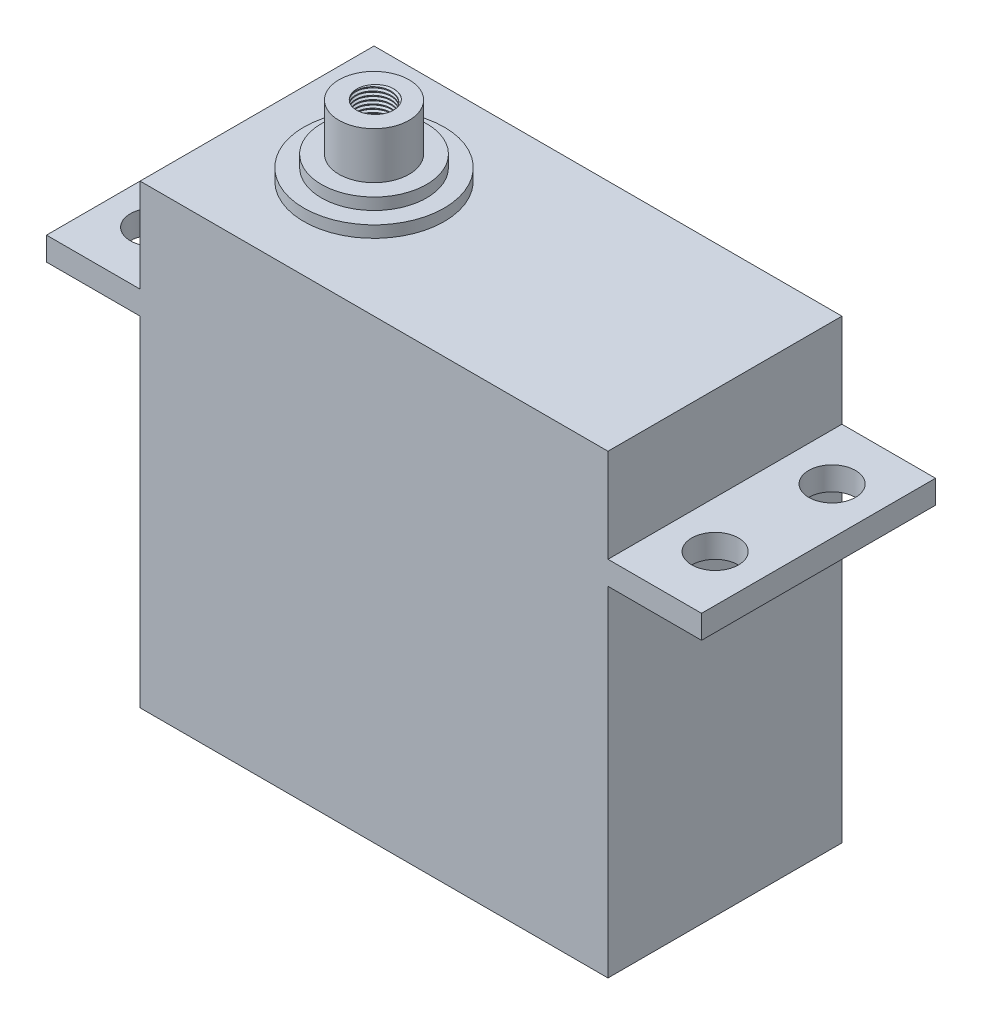
from build123d import *

# Parameters (mm, degrees)
EXTRUDE_2_DEPTH     = 20
SKETCH_5_R          = 3
EXTRUDE_4_DEPTH     = 14
SKETCH_5_4_R        = 6
EXTRUDE_5_DEPTH     = 9
SKETCH_5_5_R        = 4.5
EXTRUDE_6_DEPTH     = 10
SKETCH_5_6_R        = 2
CUT_EXTRUDE_1_DEPTH = 10
SKETCH_5_7_R        = 2
CUT_EXTRUDE_2_DEPTH = 10
SKETCH_5_8_R        = 2
CUT_EXTRUDE_3_DEPTH = 10
SKETCH_5_9_R        = 2
CUT_EXTRUDE_4_DEPTH = 10
SKETCH_6_R          = 1.5
CUT_EXTRUDE_5_DEPTH = 4
THREAD_1_PITCH      = 0.3175


with BuildPart() as part:
    # Sketch 1 → 凸台-拉伸2 (new body)
    with BuildSketch(Plane.XY):
        Polygon((-20, 12.315978), (-20, 4.315978), (-28, 4.315978), (-28, 2.315978), (-20, 2.315978), (-20, -26.684022), (20, -26.684022), (20, 2.315978), (28, 2.315978), (28, 4.315978), (20, 4.315978), (20, 12.315978), align=None)
    extrude(amount=EXTRUDE_2_DEPTH)

    # 草图5 → 凸台-拉伸4 (add)
    with BuildSketch(Plane(origin=(0, 4.315978, 0), x_dir=(1, 0, 0), z_dir=(0, 1, 0))):
        with Locations((-10, -10)):
            Circle(SKETCH_5_R)
    extrude(amount=EXTRUDE_4_DEPTH)

    # 草图5<4> → 凸台-拉伸5 (add)
    with BuildSketch(Plane(origin=(0, 4.315978, 0), x_dir=(1, 0, 0), z_dir=(0, 1, 0))):
        with Locations((-10, -10)):
            Circle(SKETCH_5_4_R)
    extrude(amount=EXTRUDE_5_DEPTH)

    # 草图5<5> → 凸台-拉伸6 (add)
    with BuildSketch(Plane(origin=(0, 4.315978, 0), x_dir=(1, 0, 0), z_dir=(0, 1, 0))):
        with Locations(Location((-10, -10, 0), (0, 0, 180))):
            Circle(SKETCH_5_5_R)
    extrude(amount=EXTRUDE_6_DEPTH)

    # 草图5<6> → 切除-拉伸1 (cut)
    with BuildSketch(Plane(origin=(0, 4.315978, 0), x_dir=(1, 0, 0), z_dir=(0, 1, 0))):
        with Locations(Location((-24, -14.839844, 0), (0, 0, 180))):
            Circle(SKETCH_5_6_R)
    extrude(amount=-CUT_EXTRUDE_1_DEPTH, mode=Mode.SUBTRACT)

    # 草图5<7> → 切除-拉伸2 (cut)
    with BuildSketch(Plane(origin=(0, 4.315978, 0), x_dir=(1, 0, 0), z_dir=(0, 1, 0))):
        with Locations(Location((-24, -4.839844, 0), (0, 0, 180))):
            Circle(SKETCH_5_7_R)
    extrude(amount=-CUT_EXTRUDE_2_DEPTH, mode=Mode.SUBTRACT)

    # 草图5<8> → 切除-拉伸3 (cut)
    with BuildSketch(Plane(origin=(0, 4.315978, 0), x_dir=(1, 0, 0), z_dir=(0, 1, 0))):
        with Locations(Location((24, -4.839844, 0), (0, 0, 270))):
            Circle(SKETCH_5_8_R)
    extrude(amount=-CUT_EXTRUDE_3_DEPTH, mode=Mode.SUBTRACT)

    # 草图5<9> → 切除-拉伸4 (cut)
    with BuildSketch(Plane(origin=(0, 4.315978, 0), x_dir=(1, 0, 0), z_dir=(0, 1, 0))):
        with Locations(Location((24, -14.839844, 0), (0, 0, 180))):
            Circle(SKETCH_5_9_R)
    extrude(amount=-CUT_EXTRUDE_4_DEPTH, mode=Mode.SUBTRACT)

    # 草图6 → 切除-拉伸5 (cut)
    with BuildSketch(Plane(origin=(0, 18.315978, 0), x_dir=(1, 0, 0), z_dir=(0, 1, 0))):
        with Locations(Location((-10, -10, 0), (0, 0, 180))):
            Circle(SKETCH_6_R)
    extrude(amount=-CUT_EXTRUDE_5_DEPTH, mode=Mode.SUBTRACT)

    # 螺纹线1: arcs per turn and ends read off the stored shape
    # 螺纹线1: the profile of Sketch 1 2 profile screwed along a right-hand helix through 12.598425 turns, 6 arcs to a turn; built about Z, then put on its axis
    thread_1_z = Axis((0, 0, 0), (0, 0, 1))
    thread_1_corners = [(1.4997, 0, -0.000173), (1.671852, 0, 0.099219), (1.671852, 0, 0.138906), (1.4997, 0, 0.238298)]
    with BuildLine(mode=Mode.PRIVATE) as thread_1_profile:
        Line(thread_1_corners[0], thread_1_corners[1])
        Line(thread_1_corners[1], thread_1_corners[2])
        Line(thread_1_corners[2], thread_1_corners[3])
        Line(thread_1_corners[3], thread_1_corners[0])
    thread_1_cap = Face(thread_1_profile.wire())
    thread_1_turn_angles = [0, 30, 60, 90, 120, 150, 180, 210, 240, 270, 300, 330, 360]
    thread_1_turn_weights = [1, 0.8660254037844387, 1, 0.8660254037844387, 1, 0.8660254037844387, 1, 0.8660254037844387, 1, 0.8660254037844387, 1, 0.8660254037844387, 1]
    thread_1_turn_rails = [Edge.make_bspline([Vector(p[0], p[1], 0).rotate(thread_1_z, thread_1_turn_angles[k]) / thread_1_turn_weights[k] + Vector(0, 0, p[2] + THREAD_1_PITCH * thread_1_turn_angles[k] / 360) for k in range(13)], [0, 0, 0, 1, 1, 2, 2, 3, 3, 4, 4, 5, 5, 6, 6, 6], 2, thread_1_turn_weights) for p in thread_1_corners]
    thread_1_turn_sides = [Face.make_surface_from_curves(thread_1_turn_rails[p[0]], thread_1_turn_rails[p[1]]) for p in [(0, 1), (1, 2), (2, 3), (3, 0)]]
    thread_1_last_angles = [4320, 4350, 4380, 4410, 4440, 4470, 4500, 4517.716535, 4535.433071]
    thread_1_last_weights = [1, 0.8660254037844387, 1, 0.8660254037844387, 1, 0.8660254037844387, 1, 0.9525736983244478, 1]
    thread_1_last_rails = [Edge.make_bspline([Vector(p[0], p[1], 0).rotate(thread_1_z, thread_1_last_angles[k]) / thread_1_last_weights[k] + Vector(0, 0, p[2] + THREAD_1_PITCH * thread_1_last_angles[k] / 360) for k in range(9)], [0, 0, 0, 1, 1, 2, 2, 3, 3, 4, 4, 4], 2, thread_1_last_weights) for p in thread_1_corners]
    thread_1_last_sides = [Face.make_surface_from_curves(thread_1_last_rails[p[0]], thread_1_last_rails[p[1]]) for p in [(0, 1), (1, 2), (2, 3), (3, 0)]]
    thread_1 = Plane(origin=(-10, 14.315978, 10), x_dir=(1, 0, 0), z_dir=(0, 1, 0)) * Solid(Shell([*[p.moved(Location((0, 0, THREAD_1_PITCH * i))) for i in range(12) for p in thread_1_turn_sides], *thread_1_last_sides, thread_1_cap, thread_1_cap.rotate(thread_1_z, 4535.433071).moved(Location((0, 0, THREAD_1_PITCH * 4535.433071 / 360)))]))
    add(thread_1, mode=Mode.SUBTRACT)


solid = part.part
